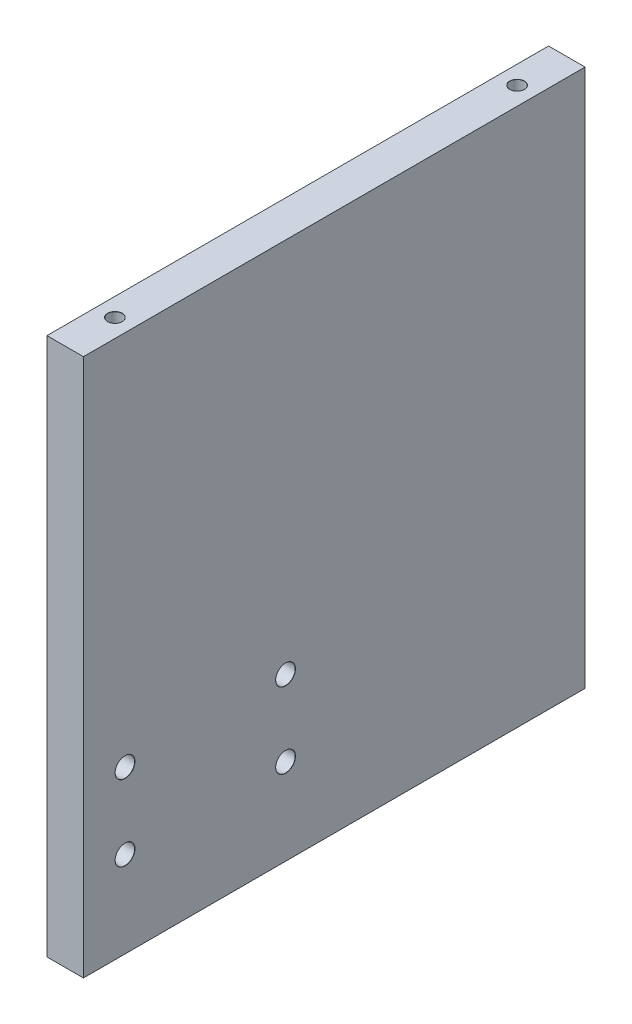
from build123d import *

# Parameters (mm, degrees)
SKETCH1_W                             = 87.3
SKETCH1_H                             = 93.65
BOSS_EXTRUDE1_DEPTH                   = 6.35
TAP_DRILL_FOR_M3X0_5_TAP1_D           = 2.5
TAP_DRILL_FOR_M3X0_5_TAP1_DEPTH       = 10
TAP_DRILL_FOR_M3X0_5_TAP1_CSINK_D     = 2.55
TAP_DRILL_FOR_M3X0_5_TAP1_CSINK_ANGLE = 90
TAP_DRILL_FOR_M3X0_5_TAP1_TIP         = 0.751075774
TAP_DRILL_FOR_M3X0_5_TAP2_D           = 2.5
TAP_DRILL_FOR_M3X0_5_TAP2_DEPTH       = 9.248924226
TAP_DRILL_FOR_M3X0_5_TAP2_CSINK_D     = 2.55
TAP_DRILL_FOR_M3X0_5_TAP2_CSINK_ANGLE = 90
TAP_DRILL_FOR_M3X0_5_TAP2_TIP         = 0.751075774
M3_CLEARANCE_HOLE1_D                  = 3.4
M3_CLEARANCE_HOLE1_CSINK_D            = 3.45
M3_CLEARANCE_HOLE1_CSINK_ANGLE        = 90


with BuildPart() as part:
    # Sketch1 → Boss-Extrude1 (new body)
    with BuildSketch(Plane(origin=(0, 0, 0), x_dir=(0, 0, -1), z_dir=(1, 0, 0))):
        Rectangle(SKETCH1_W, SKETCH1_H)
    extrude(amount=BOSS_EXTRUDE1_DEPTH)

    # Tap Drill for M3x0.5 Tap1
    with Locations(Plane(origin=(0, 46.825, 0), x_dir=(1, 0, 0), z_dir=(0, 1, 0))):
        with Locations((3.175, 35), (3.175, -35)):
            CounterSinkHole(TAP_DRILL_FOR_M3X0_5_TAP1_D / 2, TAP_DRILL_FOR_M3X0_5_TAP1_CSINK_D / 2, depth=TAP_DRILL_FOR_M3X0_5_TAP1_DEPTH, counter_sink_angle=TAP_DRILL_FOR_M3X0_5_TAP1_CSINK_ANGLE)
            with Locations((0, 0, -(TAP_DRILL_FOR_M3X0_5_TAP1_DEPTH + TAP_DRILL_FOR_M3X0_5_TAP1_TIP / 2))):  # 118° drill point
                Cone(0, TAP_DRILL_FOR_M3X0_5_TAP1_D / 2, TAP_DRILL_FOR_M3X0_5_TAP1_TIP, mode=Mode.SUBTRACT)

    # Tap Drill for M3x0.5 Tap2
    with Locations(Plane(origin=(0, -46.825, 0), x_dir=(-1, 0, 0), z_dir=(0, -1, 0))):
        with Locations((-3.175, -35), (-3.175, 35)):
            CounterSinkHole(TAP_DRILL_FOR_M3X0_5_TAP2_D / 2, TAP_DRILL_FOR_M3X0_5_TAP2_CSINK_D / 2, depth=TAP_DRILL_FOR_M3X0_5_TAP2_DEPTH, counter_sink_angle=TAP_DRILL_FOR_M3X0_5_TAP2_CSINK_ANGLE)
            with Locations((0, 0, -(TAP_DRILL_FOR_M3X0_5_TAP2_DEPTH + TAP_DRILL_FOR_M3X0_5_TAP2_TIP / 2))):  # 118° drill point
                Cone(0, TAP_DRILL_FOR_M3X0_5_TAP2_D / 2, TAP_DRILL_FOR_M3X0_5_TAP2_TIP, mode=Mode.SUBTRACT)

    # M3 Clearance Hole1 (through all)
    with Locations(Plane(origin=(6.35, 0, 0), x_dir=(0, 0, -1), z_dir=(1, 0, 0))):
        with Locations((-36.41, -18.655), (-8.47, -18.655), (-8.47, -31.825), (-36.41, -31.825)):
            CounterSinkHole(M3_CLEARANCE_HOLE1_D / 2, M3_CLEARANCE_HOLE1_CSINK_D / 2, counter_sink_angle=M3_CLEARANCE_HOLE1_CSINK_ANGLE)


solid = part.part
